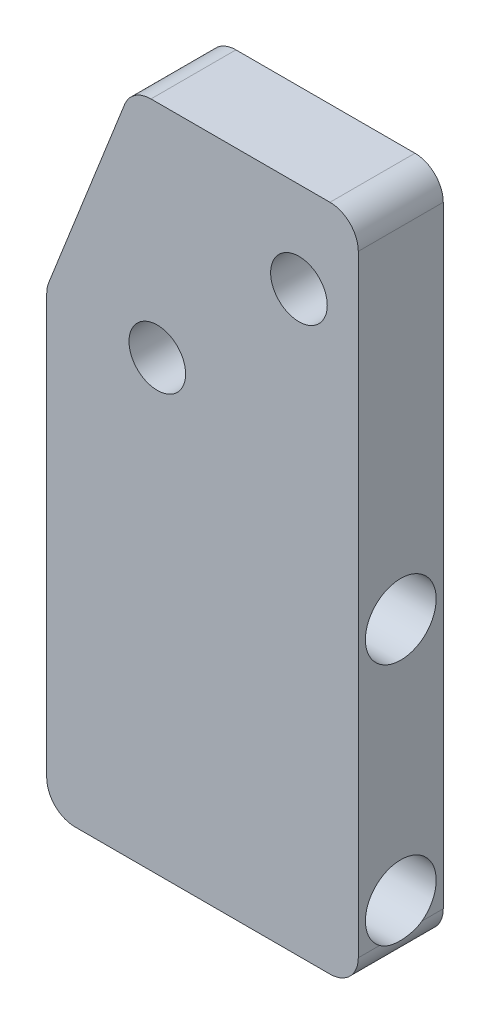
from build123d import *

# Parameters (mm, degrees)
BOSS_EXTRUDE1_DEPTH = 19.05
SKETCH2_R           = 7.9375
CUT_EXTRUDE1_DEPTH  = 15.24
SKETCH3_R           = 6.35
CUT_EXTRUDE3_DEPTH  = 167.433003338
FILLET1_R           = 6.35


with BuildPart() as part:
    # Sketch1 → Boss-Extrude1 (new body)
    with BuildSketch(Plane.XY):
        Polygon((0, 0), (0, -149.86), (-69.85, -149.86), (-69.85, -48.26), (-50.8, 0), align=None)
    extrude(amount=BOSS_EXTRUDE1_DEPTH)

    # Sketch2 → Cut-Extrude1 (cut)
    with BuildSketch(Plane(origin=(0, 0, 0), x_dir=(0, 0, -1), z_dir=(1, 0, 0))):
        with Locations((-9.525, -82.55)):
            Circle(SKETCH2_R)
        with Locations((-9.525, -137.16)):
            Circle(SKETCH2_R)
    extrude(amount=-CUT_EXTRUDE1_DEPTH, mode=Mode.SUBTRACT)

    # Sketch3 → Cut-Extrude3 (cut, through all)
    with BuildSketch(Plane.XY.offset(19.05)):
        with Locations((-45.0596, -49.53)):
            Circle(SKETCH3_R)
        with Locations((-13.3096, -20.32)):
            Circle(SKETCH3_R)
    extrude(amount=-CUT_EXTRUDE3_DEPTH, mode=Mode.SUBTRACT)

    # Fillet1
    # the kernel refuses this fillet: 6.35 mm, written as the material it takes off along each edge
    with BuildSketch(Plane(origin=(0, 0, -15.875), x_dir=(0, -1, 0), z_dir=(0, 0, 1))) as fillet1_piece_1:
        with BuildLine():
            CenterArc((FILLET1_R, -FILLET1_R), FILLET1_R, 90, 90)
            Line((0, -FILLET1_R), (0, 0))
            Line((0, 0), (FILLET1_R, 0))
        make_face()
    extrude(amount=50.8, mode=Mode.SUBTRACT)
    with BuildSketch(Plane(origin=(0, -149.86, -15.875), x_dir=(0, 1, 0), z_dir=(0, 0, 1)), Plane(origin=(-69.85, -149.86, -15.875), x_dir=(1, 0, 0), z_dir=(0, 0, 1))) as fillet1_piece_2:
        with BuildLine():
            CenterArc((FILLET1_R, FILLET1_R), FILLET1_R, 180, 90)
            Line((0, FILLET1_R), (0, 0))
            Line((0, 0), (FILLET1_R, 0))
        make_face()
    extrude(amount=50.8, mode=Mode.SUBTRACT)
    with BuildSketch(Plane(origin=(-69.85, -48.26, -3.019844557), x_dir=(0.367166534736053, 0.9301552213313209, 0), z_dir=(0, 0, 1))) as fillet1_piece_3:
        with BuildLine():
            CenterArc((FILLET1_R * 0.190226428775, -FILLET1_R), FILLET1_R, 90, 21.540975919)
            Line((-FILLET1_R * 0.176940105961, -FILLET1_R * 0.0698447786687), (0, 0))
            Line((0, 0), (FILLET1_R * 0.190226428775, 0))
        make_face()
    extrude(amount=25.089689114, mode=Mode.SUBTRACT)
    with BuildSketch(Plane(origin=(-50.8, 0, -10.800596536), x_dir=(1, 0, 0), z_dir=(0, 0, 1))) as fillet1_piece_4:
        with BuildLine():
            CenterArc((FILLET1_R * 0.680352537675, -FILLET1_R), FILLET1_R, 90, 68.459024081)
            Line((-FILLET1_R * 0.249802683657, -FILLET1_R * 0.632833465264), (0, 0))
            Line((0, 0), (FILLET1_R * 0.680352537675, 0))
        make_face()
    extrude(amount=40.651193071, mode=Mode.SUBTRACT)


solid = part.part
